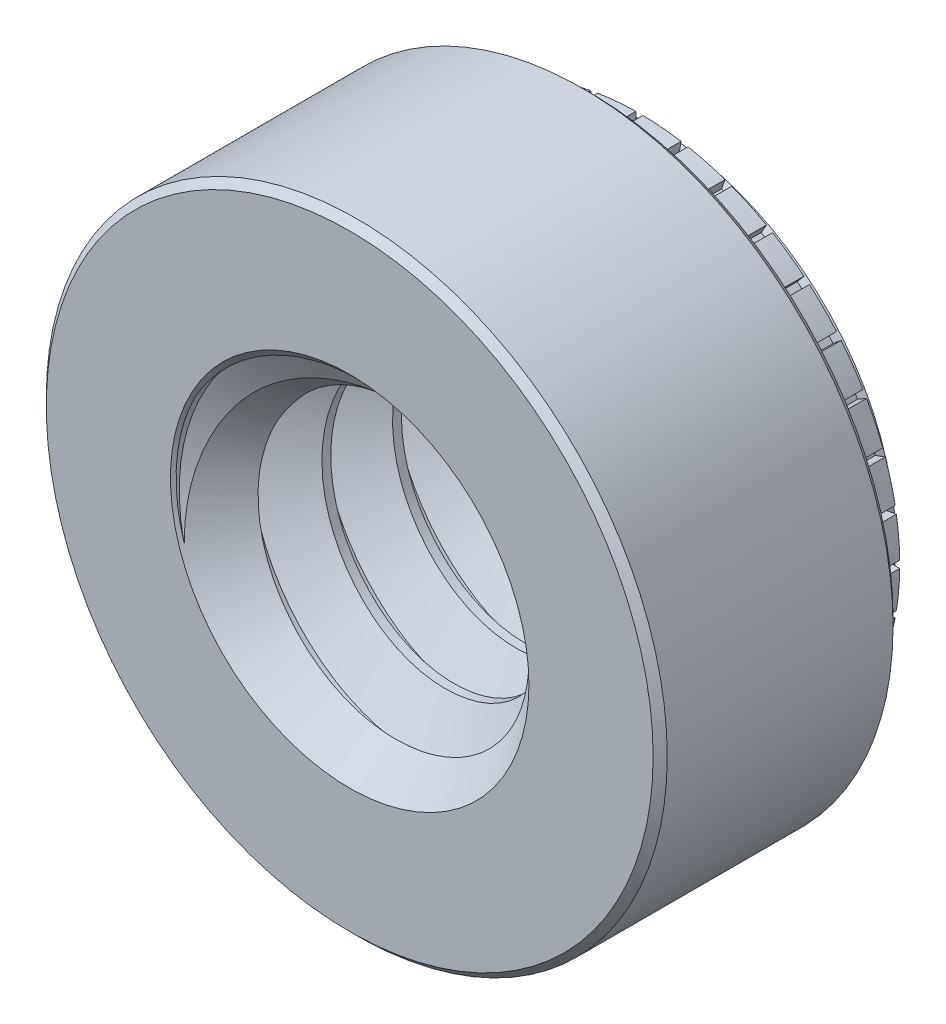
from build123d import *

# Parameters (mm, degrees)
SKETCH1_R               = 5.588
EXTRUDE1_DEPTH          = 4.318
SKETCH2_R               = 4.6863
EXTRUDE2_DEPTH          = 1.1938
SKETCH3_W               = 0.127
SKETCH3_H               = 1.0922
CUT_EXTRUDE_THIN1_DEPTH = 1.1938
CIRPATTERN1_COUNT       = 36
SKETCH5_OUTSIDE_W       = 16.742
SKETCH5_OUTSIDE_H       = 16.742
SKETCH5_OUTSIDE_R       = 4.318
CUT_EXTRUDE1_DEPTH      = 0.29845
CUT_EXTRUDE1_DRAFT      = 20
CHAMFER2_SIZE           = 0.127
SKETCH7_R               = 3.175
CUT_EXTRUDE3_DEPTH      = 10.634906706
SWEEP1_PITCH            = 1.27
SKETCH10_R              = 5.588
CUT_EXTRUDE4_DEPTH      = 11.311089901
SKETCH11_R              = 4.318
CUT_EXTRUDE5_DEPTH      = 10.634906764


with BuildPart() as part:
    # Sketch1 → Extrude1 (new body)
    with BuildSketch(Plane.XY):
        Circle(SKETCH1_R)
    extrude(amount=-EXTRUDE1_DEPTH)

    # Sketch2 → Extrude2 (add)
    with BuildSketch(Plane(origin=(0, 0, -4.318), x_dir=(-1, 0, 0), z_dir=(0, 0, -1))):
        with Locations(Location((0, 0, 0), (0, 0, 180))):
            Circle(SKETCH2_R)
    extrude(amount=EXTRUDE2_DEPTH)

    # Sketch3 → Cut-Extrude-Thin1 (cut)
    with BuildSketch(Plane(origin=(0, 0, -5.5118), x_dir=(-1, 0, 0), z_dir=(0, 0, -1))):
        with Locations((0, 5.0419)):
            Rectangle(SKETCH3_W, SKETCH3_H)
    cut_extrude_thin1 = extrude(amount=-CUT_EXTRUDE_THIN1_DEPTH, mode=Mode.SUBTRACT)

    # CirPattern1: Cut-Extrude-Thin1 ×36 about axis
    cirpattern1_axis = Axis((0, 0, 0), (0, 0, 1))
    for i in range(1, CIRPATTERN1_COUNT):
        add(cut_extrude_thin1.rotate(cirpattern1_axis, i * 360 / CIRPATTERN1_COUNT), mode=Mode.SUBTRACT)


with BuildPart() as cut_extrude1_tool:
    # Sketch5 outside → Cut-Extrude1 (with draft: the straight prism first)
    with BuildSketch(Plane(origin=(0, 0, -5.5118), x_dir=(-1, 0, 0), z_dir=(0, 0, -1))):
        Rectangle(SKETCH5_OUTSIDE_W, SKETCH5_OUTSIDE_H)
        Circle(SKETCH5_OUTSIDE_R, mode=Mode.SUBTRACT)
    extrude(amount=-CUT_EXTRUDE1_DEPTH)
    # Cut-Extrude1: the draft: its side faces are tilted about the plane it starts from
    cut_extrude1_sides = [cut_extrude1_tool.faces().sort_by_distance(p)[0] for p in [
        (0, -8.371, -5.362575),
        (-8.371, 0, -5.362575),
        (0, 8.371, -5.362575),
        (8.371, 0, -5.362575),
        (4.318, 0, -5.362575),
    ]]
    draft(cut_extrude1_sides, Plane(origin=(0, 0, -5.5118), x_dir=(-1, 0, 0), z_dir=(0, 0, -1)), CUT_EXTRUDE1_DRAFT)


with BuildPart() as part_1:
    add(part.part)

    # Cut-Extrude1: cut by cut_extrude1_tool
    add(cut_extrude1_tool.part, mode=Mode.SUBTRACT)

    # Chamfer2
    chamfer2_edges = [part_1.edges().sort_by_distance(p)[0] for p in [
        (-5.588, 0, 0),
        (-5.588, 0, -4.318),
    ]]
    chamfer(chamfer2_edges, length=CHAMFER2_SIZE)

    # Sketch7 → Cut-Extrude3 (cut, through all)
    with BuildSketch(Plane.XY):
        Circle(SKETCH7_R)
    extrude(amount=-CUT_EXTRUDE3_DEPTH, mode=Mode.SUBTRACT)

    # Sweep1: the profile of Sketch9 profile screwed along a right-hand helix of 6.84 turns, 6 arcs to a turn; built about Z, then put on its axis
    sweep1_z = Axis((0, 0, 0), (0, 0, 1))
    sweep1_corners = [(3.1753, 0, -1.111423205), (2.350110803, 0, -0.635), (2.350110803, 0, -0.47625), (3.1753, 0, 0.000173205)]
    with BuildLine(mode=Mode.PRIVATE) as sweep1_profile:
        Line(sweep1_corners[0], sweep1_corners[1])
        Line(sweep1_corners[1], sweep1_corners[2])
        Line(sweep1_corners[2], sweep1_corners[3])
        Line(sweep1_corners[3], sweep1_corners[0])
    sweep1_cap = Face(sweep1_profile.wire())
    sweep1_turn_angles = [0, 30, 60, 90, 120, 150, 180, 210, 240, 270, 300, 330, 360]
    sweep1_turn_weights = [1, 0.8660254037844387, 1, 0.8660254037844387, 1, 0.8660254037844387, 1, 0.8660254037844387, 1, 0.8660254037844387, 1, 0.8660254037844387, 1]
    sweep1_turn_rails = [Edge.make_bspline([Vector(p[0], p[1], 0).rotate(sweep1_z, sweep1_turn_angles[k]) / sweep1_turn_weights[k] + Vector(0, 0, p[2] + SWEEP1_PITCH * sweep1_turn_angles[k] / 360) for k in range(13)], [0, 0, 0, 1, 1, 2, 2, 3, 3, 4, 4, 5, 5, 6, 6, 6], 2, sweep1_turn_weights) for p in sweep1_corners]
    sweep1_turn_sides = [Face.make_surface_from_curves(sweep1_turn_rails[p[0]], sweep1_turn_rails[p[1]]) for p in [(0, 1), (1, 2), (2, 3), (3, 0)]]
    sweep1_last_angles = [2160, 2190, 2220, 2250, 2280, 2310, 2340, 2370, 2400, 2430, 2460, 2461.2, 2462.4]
    sweep1_last_weights = [1, 0.8660254037844387, 1, 0.8660254037844387, 1, 0.8660254037844387, 1, 0.8660254037844387, 1, 0.8660254037844387, 1, 0.9997806834748447, 1]
    sweep1_last_rails = [Edge.make_bspline([Vector(p[0], p[1], 0).rotate(sweep1_z, sweep1_last_angles[k]) / sweep1_last_weights[k] + Vector(0, 0, p[2] + SWEEP1_PITCH * sweep1_last_angles[k] / 360) for k in range(13)], [0, 0, 0, 1, 1, 2, 2, 3, 3, 4, 4, 5, 5, 6, 6, 6], 2, sweep1_last_weights) for p in sweep1_corners]
    sweep1_last_sides = [Face.make_surface_from_curves(sweep1_last_rails[p[0]], sweep1_last_rails[p[1]]) for p in [(0, 1), (1, 2), (2, 3), (3, 0)]]
    sweep1 = Plane(origin=(0, 0, -5.5118), x_dir=(0, 1, 0), z_dir=(0, 0, 1)) * Solid(Shell([*[p.moved(Location((0, 0, SWEEP1_PITCH * i))) for i in range(6) for p in sweep1_turn_sides], *sweep1_last_sides, sweep1_cap, sweep1_cap.rotate(sweep1_z, 2462.4).moved(Location((0, 0, SWEEP1_PITCH * 2462.4 / 360)))]))
    add(sweep1)

    # Sketch10 → Cut-Extrude4 (cut, through all)
    with BuildSketch(Plane.XY):
        Circle(SKETCH10_R)
    extrude(amount=CUT_EXTRUDE4_DEPTH, mode=Mode.SUBTRACT)

    # Sketch11 → Cut-Extrude5 (cut, through all)
    with BuildSketch(Plane(origin=(0, 0, -5.5118), x_dir=(-1, 0, 0), z_dir=(0, 0, -1))):
        Circle(SKETCH11_R)
    extrude(amount=CUT_EXTRUDE5_DEPTH, mode=Mode.SUBTRACT)

    # Cut-Extrude6 cone 1 section (through the dimple's axis) → Cut-Extrude6 (revolve, cut)
    with BuildSketch(Plane(origin=(0, 0, 0), x_dir=(0, -1, 0), z_dir=(1, 0, 0))):
        Polygon((0, 0), (3.2258, 0), (0, 3.2258), align=None)
    revolve(axis=Axis((0, 0, 0), (0, 0, -1)), mode=Mode.SUBTRACT)

    # Cut-Extrude7 cone 1 section (through the dimple's axis) → Cut-Extrude7 (revolve, cut)
    with BuildSketch(Plane(origin=(0, 0, -5.5118), x_dir=(0, 1, 0), z_dir=(1, 0, 0))):
        Polygon((0, 0), (3.2258, 0), (0, 3.2258), align=None)
    revolve(axis=Axis((0, 0, -5.5118), (0, 0, 1)), mode=Mode.SUBTRACT)


solid = part_1.part
